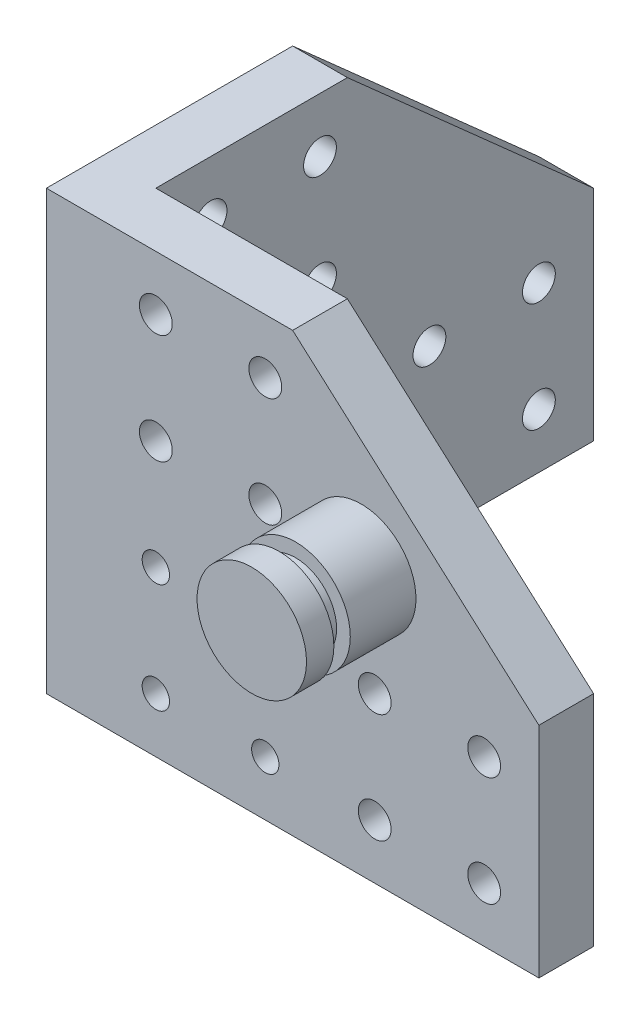
from build123d import *

# Parameters (mm, degrees)
BOSS_EXTRUDE1_DEPTH = 80
CUT_EXTRUDE1_REACH  = 152.333
CUT_EXTRUDE2_REACH  = 152.333
CUT_EXTRUDE3_REACH  = 152.333
SKETCH4_R           = 2.5
SKETCH4_R_2         = 3
CUT_EXTRUDE4_REACH  = 152.333
SKETCH5_R           = 3
SKETCH6_R           = 10
BOSS_EXTRUDE2_DEPTH = 20
CUT_EXTRUDE5_START  = -8
SKETCH7_R           = 10
SKETCH7_R_2         = 7.5
CUT_EXTRUDE5_DEPTH  = 3
SKETCH8_R           = 10
BOSS_EXTRUDE3_DEPTH = 20
CUT_EXTRUDE6_START  = -8
SKETCH9_R           = 10
SKETCH9_R_2         = 7.5
CUT_EXTRUDE6_DEPTH  = 3


with BuildPart() as part:
    # Sketch1 → Boss-Extrude1 (new body)
    with BuildSketch(Plane(origin=(0, 0, 0), x_dir=(1, 0, 0), z_dir=(0, 1, 0))):
        Polygon((0, 0), (90, 0), (90, 10), (10, 10), (10, 90), (0, 90), align=None)
    extrude(amount=BOSS_EXTRUDE1_DEPTH)

    # Sketch2 → Cut-Extrude1 (cut, up to next)
    with BuildSketch(Plane.XY, mode=Mode.PRIVATE) as cut_extrude1_sk1:
        Polygon((90, 80), (90, 40), (45, 80), align=None)
    cut_extrude1_tool1 = extrude(cut_extrude1_sk1.sketch, amount=-CUT_EXTRUDE1_REACH, mode=Mode.PRIVATE) & part.part
    add(cut_extrude1_tool1.solids().sort_by_distance((75, 66.666667, 0))[0], mode=Mode.SUBTRACT)

    # Sketch3 → Cut-Extrude2 (cut, up to next)
    with BuildSketch(Plane.ZY, mode=Mode.PRIVATE) as cut_extrude2_sk1:
        Polygon((-45, 80), (-90, 40), (-90, 80), align=None)
    cut_extrude2_tool1 = extrude(cut_extrude2_sk1.sketch, amount=-CUT_EXTRUDE2_REACH, mode=Mode.PRIVATE) & part.part
    add(cut_extrude2_tool1.solids().sort_by_distance((0, 66.666667, -75))[0], mode=Mode.SUBTRACT)

    # Sketch4 → Cut-Extrude3 (cut, up to next)
    with BuildSketch(Plane.XY, mode=Mode.PRIVATE) as cut_extrude3_sk1:
        with Locations((20, 30)):
            Circle(SKETCH4_R)
    cut_extrude3_tool1 = extrude(cut_extrude3_sk1.sketch, amount=-CUT_EXTRUDE3_REACH, mode=Mode.PRIVATE) & part.part
    # Sketch4 → Cut-Extrude3 (cut, up to next)
    with BuildSketch(Plane.XY, mode=Mode.PRIVATE) as cut_extrude3_sk2:
        with Locations((40, 30)):
            Circle(SKETCH4_R)
    cut_extrude3_tool2 = extrude(cut_extrude3_sk2.sketch, amount=-CUT_EXTRUDE3_REACH, mode=Mode.PRIVATE) & part.part
    # Sketch4 → Cut-Extrude3 (cut, up to next)
    with BuildSketch(Plane.XY, mode=Mode.PRIVATE) as cut_extrude3_sk3:
        with Locations((20, 10)):
            Circle(SKETCH4_R)
    cut_extrude3_tool3 = extrude(cut_extrude3_sk3.sketch, amount=-CUT_EXTRUDE3_REACH, mode=Mode.PRIVATE) & part.part
    # Sketch4 → Cut-Extrude3 (cut, up to next)
    with BuildSketch(Plane.XY, mode=Mode.PRIVATE) as cut_extrude3_sk4:
        with Locations((40, 10)):
            Circle(SKETCH4_R)
    cut_extrude3_tool4 = extrude(cut_extrude3_sk4.sketch, amount=-CUT_EXTRUDE3_REACH, mode=Mode.PRIVATE) & part.part
    # Sketch4 → Cut-Extrude3 (cut, up to next)
    with BuildSketch(Plane.XY, mode=Mode.PRIVATE) as cut_extrude3_sk5:
        with Locations((60, 10)):
            Circle(SKETCH4_R_2)
    cut_extrude3_tool5 = extrude(cut_extrude3_sk5.sketch, amount=-CUT_EXTRUDE3_REACH, mode=Mode.PRIVATE) & part.part
    # Sketch4 → Cut-Extrude3 (cut, up to next)
    with BuildSketch(Plane.XY, mode=Mode.PRIVATE) as cut_extrude3_sk6:
        with Locations((80, 10)):
            Circle(SKETCH4_R_2)
    cut_extrude3_tool6 = extrude(cut_extrude3_sk6.sketch, amount=-CUT_EXTRUDE3_REACH, mode=Mode.PRIVATE) & part.part
    # Sketch4 → Cut-Extrude3 (cut, up to next)
    with BuildSketch(Plane.XY, mode=Mode.PRIVATE) as cut_extrude3_sk7:
        with Locations((60, 30)):
            Circle(SKETCH4_R_2)
    cut_extrude3_tool7 = extrude(cut_extrude3_sk7.sketch, amount=-CUT_EXTRUDE3_REACH, mode=Mode.PRIVATE) & part.part
    # Sketch4 → Cut-Extrude3 (cut, up to next)
    with BuildSketch(Plane.XY, mode=Mode.PRIVATE) as cut_extrude3_sk8:
        with Locations((80, 30)):
            Circle(SKETCH4_R_2)
    cut_extrude3_tool8 = extrude(cut_extrude3_sk8.sketch, amount=-CUT_EXTRUDE3_REACH, mode=Mode.PRIVATE) & part.part
    # Sketch4 → Cut-Extrude3 (cut, up to next)
    with BuildSketch(Plane.XY, mode=Mode.PRIVATE) as cut_extrude3_sk9:
        with Locations((40, 50)):
            Circle(SKETCH4_R_2)
    cut_extrude3_tool9 = extrude(cut_extrude3_sk9.sketch, amount=-CUT_EXTRUDE3_REACH, mode=Mode.PRIVATE) & part.part
    # Sketch4 → Cut-Extrude3 (cut, up to next)
    with BuildSketch(Plane.XY, mode=Mode.PRIVATE) as cut_extrude3_sk10:
        with Locations((20, 50)):
            Circle(SKETCH4_R_2)
    cut_extrude3_tool10 = extrude(cut_extrude3_sk10.sketch, amount=-CUT_EXTRUDE3_REACH, mode=Mode.PRIVATE) & part.part
    # Sketch4 → Cut-Extrude3 (cut, up to next)
    with BuildSketch(Plane.XY, mode=Mode.PRIVATE) as cut_extrude3_sk11:
        with Locations((20, 70)):
            Circle(SKETCH4_R_2)
    cut_extrude3_tool11 = extrude(cut_extrude3_sk11.sketch, amount=-CUT_EXTRUDE3_REACH, mode=Mode.PRIVATE) & part.part
    # Sketch4 → Cut-Extrude3 (cut, up to next)
    with BuildSketch(Plane.XY, mode=Mode.PRIVATE) as cut_extrude3_sk12:
        with Locations((40, 70)):
            Circle(SKETCH4_R_2)
    cut_extrude3_tool12 = extrude(cut_extrude3_sk12.sketch, amount=-CUT_EXTRUDE3_REACH, mode=Mode.PRIVATE) & part.part
    add(cut_extrude3_tool1.solids().sort_by_distance((20, 30, 0))[0], mode=Mode.SUBTRACT)
    add(cut_extrude3_tool2.solids().sort_by_distance((40, 30, 0))[0], mode=Mode.SUBTRACT)
    add(cut_extrude3_tool3.solids().sort_by_distance((20, 10, 0))[0], mode=Mode.SUBTRACT)
    add(cut_extrude3_tool4.solids().sort_by_distance((40, 10, 0))[0], mode=Mode.SUBTRACT)
    add(cut_extrude3_tool5.solids().sort_by_distance((60, 10, 0))[0], mode=Mode.SUBTRACT)
    add(cut_extrude3_tool6.solids().sort_by_distance((80, 10, 0))[0], mode=Mode.SUBTRACT)
    add(cut_extrude3_tool7.solids().sort_by_distance((60, 30, 0))[0], mode=Mode.SUBTRACT)
    add(cut_extrude3_tool8.solids().sort_by_distance((80, 30, 0))[0], mode=Mode.SUBTRACT)
    add(cut_extrude3_tool9.solids().sort_by_distance((40, 50, 0))[0], mode=Mode.SUBTRACT)
    add(cut_extrude3_tool10.solids().sort_by_distance((20, 50, 0))[0], mode=Mode.SUBTRACT)
    add(cut_extrude3_tool11.solids().sort_by_distance((20, 70, 0))[0], mode=Mode.SUBTRACT)
    add(cut_extrude3_tool12.solids().sort_by_distance((40, 70, 0))[0], mode=Mode.SUBTRACT)

    # Sketch5 → Cut-Extrude4 (cut, up to next)
    with BuildSketch(Plane.ZY, mode=Mode.PRIVATE) as cut_extrude4_sk1:
        with Locations((-20, 70)):
            Circle(SKETCH5_R)
    cut_extrude4_tool1 = extrude(cut_extrude4_sk1.sketch, amount=-CUT_EXTRUDE4_REACH, mode=Mode.PRIVATE) & part.part
    # Sketch5 → Cut-Extrude4 (cut, up to next)
    with BuildSketch(Plane.ZY, mode=Mode.PRIVATE) as cut_extrude4_sk2:
        with Locations((-40, 70)):
            Circle(SKETCH5_R)
    cut_extrude4_tool2 = extrude(cut_extrude4_sk2.sketch, amount=-CUT_EXTRUDE4_REACH, mode=Mode.PRIVATE) & part.part
    # Sketch5 → Cut-Extrude4 (cut, up to next)
    with BuildSketch(Plane.ZY, mode=Mode.PRIVATE) as cut_extrude4_sk3:
        with Locations((-20, 50)):
            Circle(SKETCH5_R)
    cut_extrude4_tool3 = extrude(cut_extrude4_sk3.sketch, amount=-CUT_EXTRUDE4_REACH, mode=Mode.PRIVATE) & part.part
    # Sketch5 → Cut-Extrude4 (cut, up to next)
    with BuildSketch(Plane.ZY, mode=Mode.PRIVATE) as cut_extrude4_sk4:
        with Locations((-40, 50)):
            Circle(SKETCH5_R)
    cut_extrude4_tool4 = extrude(cut_extrude4_sk4.sketch, amount=-CUT_EXTRUDE4_REACH, mode=Mode.PRIVATE) & part.part
    # Sketch5 → Cut-Extrude4 (cut, up to next)
    with BuildSketch(Plane.ZY, mode=Mode.PRIVATE) as cut_extrude4_sk5:
        with Locations((-20, 30)):
            Circle(SKETCH5_R)
    cut_extrude4_tool5 = extrude(cut_extrude4_sk5.sketch, amount=-CUT_EXTRUDE4_REACH, mode=Mode.PRIVATE) & part.part
    # Sketch5 → Cut-Extrude4 (cut, up to next)
    with BuildSketch(Plane.ZY, mode=Mode.PRIVATE) as cut_extrude4_sk6:
        with Locations((-40, 30)):
            Circle(SKETCH5_R)
    cut_extrude4_tool6 = extrude(cut_extrude4_sk6.sketch, amount=-CUT_EXTRUDE4_REACH, mode=Mode.PRIVATE) & part.part
    # Sketch5 → Cut-Extrude4 (cut, up to next)
    with BuildSketch(Plane.ZY, mode=Mode.PRIVATE) as cut_extrude4_sk7:
        with Locations((-20, 10)):
            Circle(SKETCH5_R)
    cut_extrude4_tool7 = extrude(cut_extrude4_sk7.sketch, amount=-CUT_EXTRUDE4_REACH, mode=Mode.PRIVATE) & part.part
    # Sketch5 → Cut-Extrude4 (cut, up to next)
    with BuildSketch(Plane.ZY, mode=Mode.PRIVATE) as cut_extrude4_sk8:
        with Locations((-40, 10)):
            Circle(SKETCH5_R)
    cut_extrude4_tool8 = extrude(cut_extrude4_sk8.sketch, amount=-CUT_EXTRUDE4_REACH, mode=Mode.PRIVATE) & part.part
    # Sketch5 → Cut-Extrude4 (cut, up to next)
    with BuildSketch(Plane.ZY, mode=Mode.PRIVATE) as cut_extrude4_sk9:
        with Locations((-60, 10)):
            Circle(SKETCH5_R)
    cut_extrude4_tool9 = extrude(cut_extrude4_sk9.sketch, amount=-CUT_EXTRUDE4_REACH, mode=Mode.PRIVATE) & part.part
    # Sketch5 → Cut-Extrude4 (cut, up to next)
    with BuildSketch(Plane.ZY, mode=Mode.PRIVATE) as cut_extrude4_sk10:
        with Locations((-60, 30)):
            Circle(SKETCH5_R)
    cut_extrude4_tool10 = extrude(cut_extrude4_sk10.sketch, amount=-CUT_EXTRUDE4_REACH, mode=Mode.PRIVATE) & part.part
    # Sketch5 → Cut-Extrude4 (cut, up to next)
    with BuildSketch(Plane.ZY, mode=Mode.PRIVATE) as cut_extrude4_sk11:
        with Locations((-80, 30)):
            Circle(SKETCH5_R)
    cut_extrude4_tool11 = extrude(cut_extrude4_sk11.sketch, amount=-CUT_EXTRUDE4_REACH, mode=Mode.PRIVATE) & part.part
    # Sketch5 → Cut-Extrude4 (cut, up to next)
    with BuildSketch(Plane.ZY, mode=Mode.PRIVATE) as cut_extrude4_sk12:
        with Locations((-80, 10)):
            Circle(SKETCH5_R)
    cut_extrude4_tool12 = extrude(cut_extrude4_sk12.sketch, amount=-CUT_EXTRUDE4_REACH, mode=Mode.PRIVATE) & part.part
    add(cut_extrude4_tool1.solids().sort_by_distance((0, 70, -20))[0], mode=Mode.SUBTRACT)
    add(cut_extrude4_tool2.solids().sort_by_distance((0, 70, -40))[0], mode=Mode.SUBTRACT)
    add(cut_extrude4_tool3.solids().sort_by_distance((0, 50, -20))[0], mode=Mode.SUBTRACT)
    add(cut_extrude4_tool4.solids().sort_by_distance((0, 50, -40))[0], mode=Mode.SUBTRACT)
    add(cut_extrude4_tool5.solids().sort_by_distance((0, 30, -20))[0], mode=Mode.SUBTRACT)
    add(cut_extrude4_tool6.solids().sort_by_distance((0, 30, -40))[0], mode=Mode.SUBTRACT)
    add(cut_extrude4_tool7.solids().sort_by_distance((0, 10, -20))[0], mode=Mode.SUBTRACT)
    add(cut_extrude4_tool8.solids().sort_by_distance((0, 10, -40))[0], mode=Mode.SUBTRACT)
    add(cut_extrude4_tool9.solids().sort_by_distance((0, 10, -60))[0], mode=Mode.SUBTRACT)
    add(cut_extrude4_tool10.solids().sort_by_distance((0, 30, -60))[0], mode=Mode.SUBTRACT)
    add(cut_extrude4_tool11.solids().sort_by_distance((0, 30, -80))[0], mode=Mode.SUBTRACT)
    add(cut_extrude4_tool12.solids().sort_by_distance((0, 10, -80))[0], mode=Mode.SUBTRACT)

    # Sketch6 → Boss-Extrude2 (add)
    with BuildSketch(Plane.ZY):
        with Locations((-57.534542418, 48.78886022)):
            Circle(SKETCH6_R)
    extrude(amount=BOSS_EXTRUDE2_DEPTH)

    # Sketch7 → Cut-Extrude5 (cut)
    with BuildSketch(Plane.ZY.offset(20).offset(CUT_EXTRUDE5_START)):
        with Locations((-57.534542418, 48.78886022)):
            Circle(SKETCH7_R)
        with Locations((-57.534542418, 48.78886022)):
            Circle(SKETCH7_R_2, mode=Mode.SUBTRACT)
    extrude(amount=CUT_EXTRUDE5_DEPTH, mode=Mode.SUBTRACT)

    # Sketch8 → Boss-Extrude3 (add)
    with BuildSketch(Plane.XY):
        with Locations((57.534542418, 48.78886022)):
            Circle(SKETCH8_R)
    extrude(amount=BOSS_EXTRUDE3_DEPTH)

    # Sketch9 → Cut-Extrude6 (cut)
    with BuildSketch(Plane.XY.offset(20).offset(CUT_EXTRUDE6_START)):
        with Locations((57.534542418, 48.78886022)):
            Circle(SKETCH9_R)
        with Locations((57.534542418, 48.78886022)):
            Circle(SKETCH9_R_2, mode=Mode.SUBTRACT)
    extrude(amount=CUT_EXTRUDE6_DEPTH, mode=Mode.SUBTRACT)


solid = part.part
